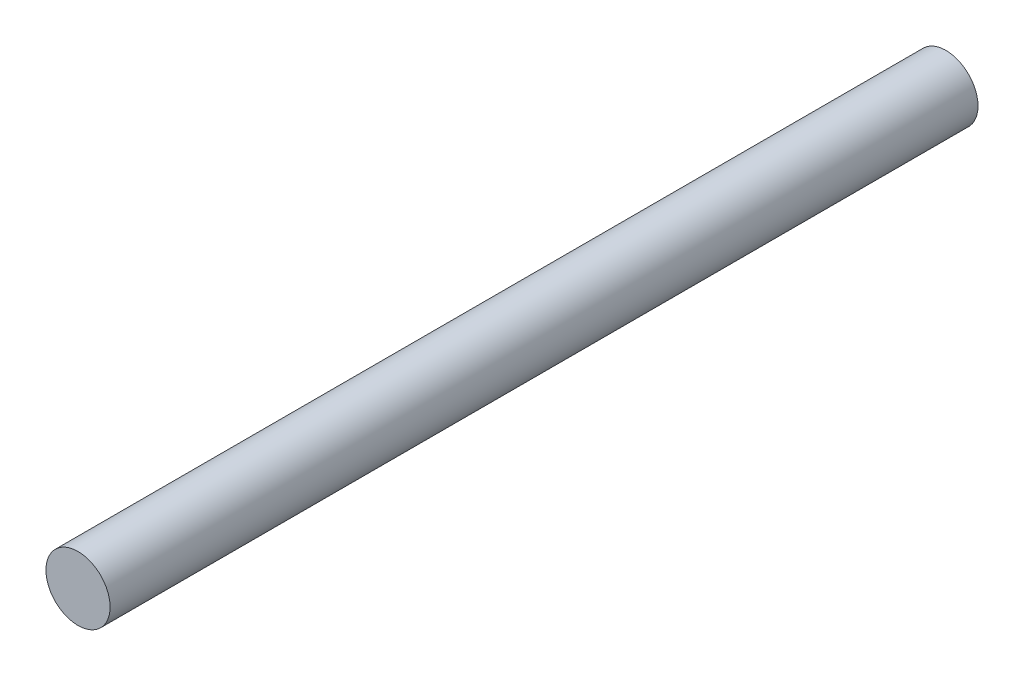
from build123d import *

# Parameters (mm, degrees)
SKETCH1_R           = 4.7879
BOSS_EXTRUDE1_DEPTH = 129.54


with BuildPart() as part:
    # Sketch1 → Boss-Extrude1 (new body)
    with BuildSketch(Plane.XY):
        Circle(SKETCH1_R)
    extrude(amount=BOSS_EXTRUDE1_DEPTH)


solid = part.part
